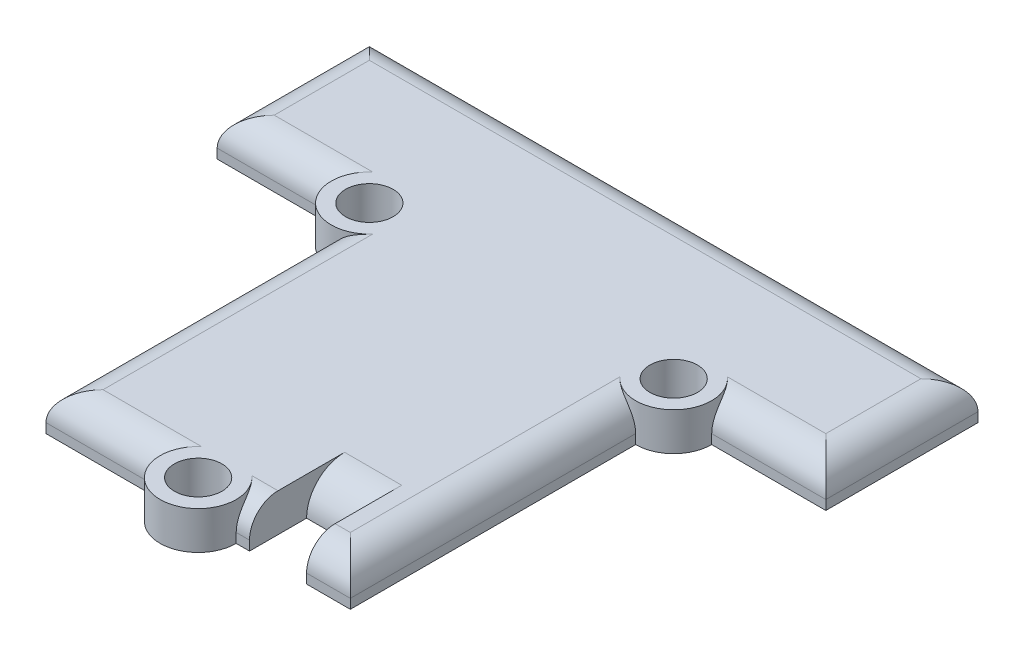
from build123d import *

# Parameters (mm, degrees)
ESQUISSE1_W             = 32
ESQUISSE1_H             = 8
BOSS_EXTRU_1_DEPTH      = 2
BOSS_EXTRU_2_DEPTH      = 2
ESQUISSE3_R             = 1.9999999999999996
ESQUISSE3_R_2           = 2.000000000000003
ESQUISSE3_R_3           = 1.9999999999999991
BOSS_EXTRU_3_DEPTH      = 2
ESQUISSE4_R             = 1.2499999999999991
ESQUISSE4_R_2           = 1.250000000000001
ESQUISSE4_R_3           = 1.2500000000000013
ENL_V_MAT_EXTRU_1_DEPTH = 2
CONG_1_R                = 1.5
ENL_V_MAT_EXTRU_2_DEPTH = 38.26929044937668
CONG_2_R                = 2


with BuildPart() as part:
    # Esquisse1 → Boss.-Extru.1 (new body)
    with BuildSketch(Plane(origin=(0, 0, 0), x_dir=(1, 0, 0), z_dir=(0, 1, 0))):
        with Locations((16, 4)):
            Rectangle(ESQUISSE1_W, ESQUISSE1_H)
    extrude(amount=BOSS_EXTRU_1_DEPTH)

    # Esquisse2 → Boss.-Extru.2 (add)
    with BuildSketch(Plane(origin=(0, 2, 0), x_dir=(1, 0, 0), z_dir=(0, 1, 0))):
        Polygon((8.000000000000002, 4.5e-16), (24, 2.41e-15), (24.000000000000004, -17), (8.000000000000004, -17), align=None)
    extrude(amount=-BOSS_EXTRU_2_DEPTH)

    # Esquisse3 → Boss.-Extru.3 (add)
    with BuildSketch(Plane(origin=(0, 2, 0), x_dir=(1, 0, 0), z_dir=(0, 1, 0))):
        with Locations((8.000000000000002, 0)):
            Circle(ESQUISSE3_R)
        with Locations((24, 2.41e-15)):
            Circle(ESQUISSE3_R_2)
        with Locations((16.000000000000004, -17)):
            Circle(ESQUISSE3_R_3)
    extrude(amount=-BOSS_EXTRU_3_DEPTH)

    # Esquisse4 → Enlèv. mat.-Extru.1 (cut)
    with BuildSketch(Plane(origin=(0, 2, 0), x_dir=(1, 0, 0), z_dir=(0, 1, 0))):
        with Locations(Location((8.000000000000002, 0, 0), (0, 0, 270))):
            Circle(ESQUISSE4_R)
        with Locations(Location((24, 2.41e-15, 0), (0, 0, 270))):
            Circle(ESQUISSE4_R_2)
        with Locations(Location((16.000000000000004, -17, 0), (0, 0, 270))):
            Circle(ESQUISSE4_R_3)
    extrude(amount=-ENL_V_MAT_EXTRU_1_DEPTH, mode=Mode.SUBTRACT)

    # Congé1
    cong_1_edges = [part.edges().sort_by_distance(p)[0] for p in [
        (32, 2, -4),
        (16, 2, -8),
        (11.000000000000004, 2, 17),
        (24.000000000000004, 2, 9.500000000000002),
        (8.000000000000004, 2, 9.5),
        (29, 2, 0),
        (0, 2, -4),
        (21.000000000000004, 2, 17),
        (3.000000000000001, 2, 0),
    ]]
    fillet(cong_1_edges, radius=CONG_1_R)

    # Esquisse5 → Enlèv. mat.-Extru.2 (cut, through all)
    with BuildSketch(Plane.XZ):
        Polygon((21.700000000000003, 17), (18.700000000000003, 17), (18.70000000000001, 14.000000000000002), (21.700000000000006, 14.000000000000002), align=None)
    extrude(amount=-ENL_V_MAT_EXTRU_2_DEPTH, mode=Mode.SUBTRACT)

    # Congé2
    cong_2_edges = [part.edges().sort_by_distance(p)[0] for p in [
        (20.20000000000001, 2, 14),
    ]]
    fillet(cong_2_edges, radius=CONG_2_R - 0.0001)  # a hair under: the kernel refuses the full size


solid = part.part
